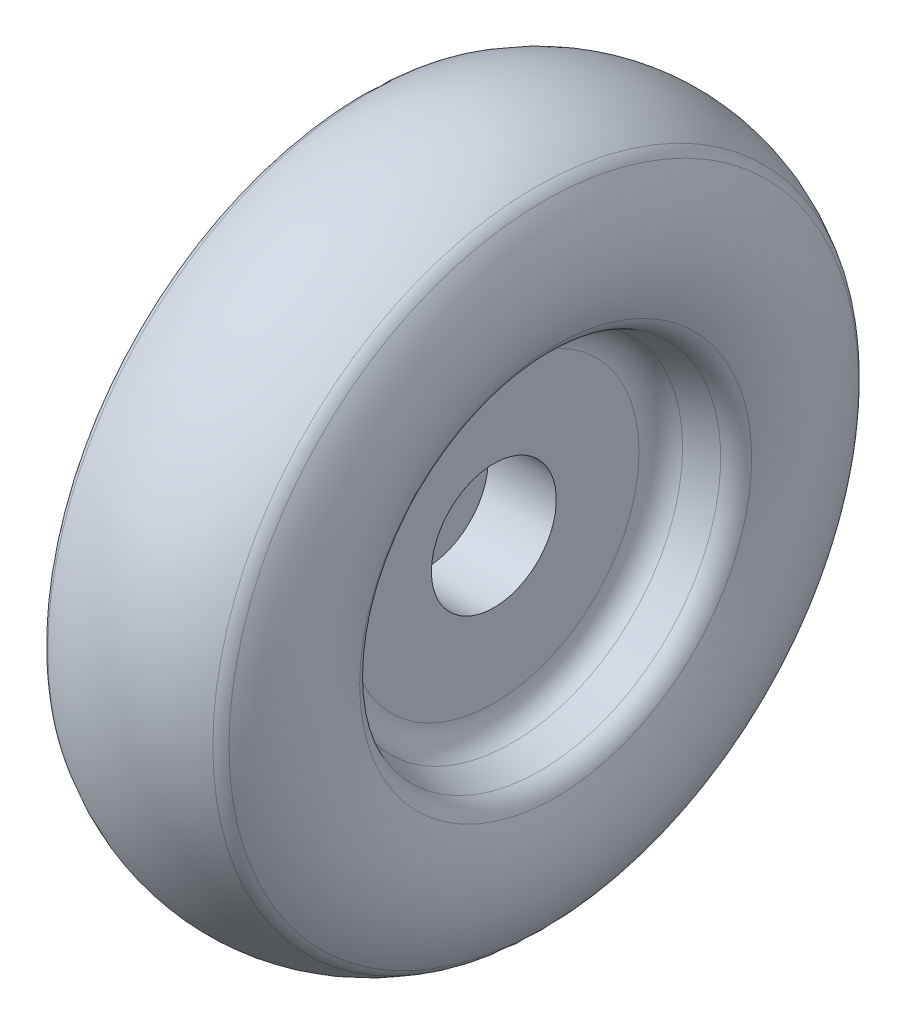
from build123d import *

# Parameters (mm, degrees)
BOSS_EXTRUDE1_DEPTH      = 15
BOSS_EXTRUDE1_DEPTH_BACK = 15
SKETCH9_R                = 82.980405075
FILLET1_R                = 10
FILLET2_R                = 10
SKETCH10_R               = 7.5
CUT_EXTRUDE1_DEPTH       = 217
SCALE1_SCALE             = 0.06
SKETCH11_R               = 0.65
CUT_EXTRUDE2_DEPTH       = 0.3
SKETCH12_R               = 1.375
CUT_EXTRUDE3_DEPTH       = 12.202693298


# Read off the part's stored shape, not the designer's step: 4WD+Public+Release+v2.stp-1-1/10 in Wheel v6_2.stp-1-1/Hub Outer_2.stp-1-1-solid1, 4WD+Public+Release+v2.stp-1-1/10 in Wheel v6_2.stp-1-1/Tire_2.stp-1-1-solid1
with BuildPart() as part:
    # Sketch4 → Revolve1 (revolve)
    with BuildSketch(Plane(origin=(0, 0, 0), x_dir=(1, 0, 0), z_dir=(0, 1, 0)), mode=Mode.PRIVATE) as revolve1_sk:
        with BuildLine():
            Line((178.555, 54.868508928), (142.882367679, 67.779692093))
            ThreePointArc((142.882367679, 67.779692093), (137.401406362, 93.056409756), (146.493772776, 117.269676074))
            ThreePointArc((146.493772776, 117.269676074), (167.073162285, 125.799877163), (189.35, 125.93443048))
            ThreePointArc((189.35, 125.93443048), (197.261254179, 123.846099939), (204.799435578, 120.664136972))
            ThreePointArc((204.799435578, 120.664136972), (207.757194609, 119.051495943), (210.616227227, 117.26967607))
            ThreePointArc((210.616227227, 117.26967607), (216.011090665, 108.029767793), (219.113930019, 97.79))
            ThreePointArc((219.113930019, 97.79), (219.685241725, 93.362296783), (219.822574385, 88.9))
            ThreePointArc((219.822574385, 88.9), (218.303521616, 78.001182607), (214.227632321, 67.779692093))
            Line((214.227632321, 67.779692093), (178.555, 54.868508928))
        make_face()
    revolve(revolve1_sk.sketch.rotate(Axis((0, 0, 0), (1, 0, 0)), 180), axis=Axis((0, 0, 0), (1, 0, 0)))

    # Sketch9 → Boss-Extrude1 (add, two sides: drawn at the far end of the back side and taken through both)
    with BuildSketch(Plane(origin=(178.555, 0, 0), x_dir=(0, 0, -1), z_dir=(1, 0, 0)).offset(-BOSS_EXTRUDE1_DEPTH_BACK)):
        Circle(SKETCH9_R)
    extrude(amount=BOSS_EXTRUDE1_DEPTH + BOSS_EXTRUDE1_DEPTH_BACK)

    # Fillet1
    fillet1_edges = [part.edges().sort_by_distance(p)[0] for p in [
        (163.555, 0, -60.297537706),
        (193.555, 0, -60.297537706),
    ]]
    fillet(fillet1_edges, radius=FILLET1_R)

    # Fillet2
    fillet2_edges = [part.edges().sort_by_distance(p)[0] for p in [
        (210.616227227, 0, -117.26967607),
        (214.227632321, 0, -67.779692093),
        (142.882367679, 0, -67.779692093),
        (146.493772776, 0, -117.269676074),
    ]]
    fillet(fillet2_edges, radius=FILLET2_R)

    # Sketch10 → Cut-Extrude1 (cut)
    with BuildSketch(Plane(origin=(193.555, 0, 0), x_dir=(0, 0, -1), z_dir=(1, 0, 0))):
        Circle(SKETCH10_R)
    extrude(amount=-CUT_EXTRUDE1_DEPTH, mode=Mode.SUBTRACT)


with BuildPart() as part_1:
    # Scale1: scaled about (178.555, 0, -7.2e-08)
    add(part.part.scale(SCALE1_SCALE).moved(Location((167.8417, 0, -6.8e-08))))

    # Sketch11 → Cut-Extrude2 (cut)
    with BuildSketch(Plane.ZY.offset(-177.655)):
        Circle(SKETCH11_R)
    extrude(amount=-CUT_EXTRUDE2_DEPTH, mode=Mode.SUBTRACT)

    # Sketch12 → Cut-Extrude3 (cut, through all)
    with BuildSketch(Plane.ZY.offset(-177.955)):
        Circle(SKETCH12_R)
    extrude(amount=-CUT_EXTRUDE3_DEPTH, mode=Mode.SUBTRACT)


solid = part_1.part
